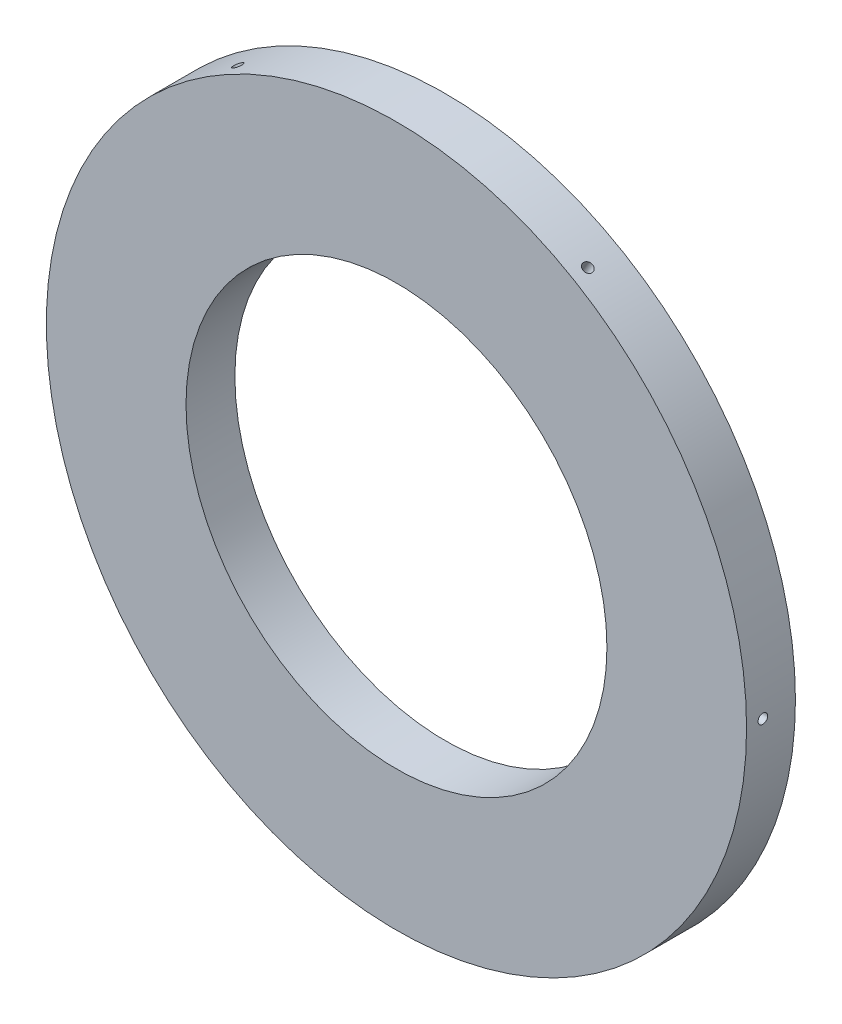
from build123d import *

# Parameters (mm, degrees)
SKETCH1_R                = 81.8896
SKETCH1_R_2              = 49.225199999999994
BOSS_EXTRUDE1_DEPTH      = 11.43
CIRPATTERN1_COUNT        = 6
CUT_EXTRUDE1_DEPTH       = 10.921999999999999
FILLET2_R                = 4.9276
FILLET4_R                = 6.35
FILLET3_R                = 1.5875
CIRPATTERN2_COUNT        = 6
FILLET2_OF_CIRPATTERN2_R = 4.9276
FILLET4_OF_CIRPATTERN2_R = 6.35
FILLET3_OF_CIRPATTERN2_R = 1.5875


with BuildPart() as part:
    # Sketch1 → Boss-Extrude1 (new body)
    with BuildSketch(Plane.XY):
        Circle(SKETCH1_R)
        Circle(SKETCH1_R_2, mode=Mode.SUBTRACT)
    extrude(amount=BOSS_EXTRUDE1_DEPTH)

    # Sketch2 → #4-40 Tapped Hole1 (revolve, cut)
    with BuildSketch(Plane(origin=(81.8896, 0, 7.62), x_dir=(0, 0, -1), z_dir=(-1.2e-16, 1, 0))):
        Polygon((0, 0), (-2.03e-15, 8.273752757686852), (1.130299999999998, 7.594599999999999), (1.130299999999999, -1e-17), align=None)
    f_4_40_tapped_hole1 = revolve(axis=Axis((88.2396, 7.8e-16, 7.62), (-1, -1.2e-16, 0)), mode=Mode.SUBTRACT)

    # CirPattern1: #4-40 Tapped Hole1 ×6 about axis
    cirpattern1_axis = Axis((0, 0, 11.43), (0, 0, -1))
    for i in range(1, CIRPATTERN1_COUNT):
        add(f_4_40_tapped_hole1.rotate(cirpattern1_axis, i * 360 / CIRPATTERN1_COUNT), mode=Mode.SUBTRACT)

    # Sketch3 → Cut-Extrude1 (cut)
    with BuildSketch(Plane.XY):
        with BuildLine():
            ThreePointArc((27.78089806339295, 42.682326925688685), (44.10407573853007, 25.463500000000053), (50.85442844197543, 2.7178))
            Line((50.85442844197543, 2.7178), (81.08206364492705, 2.7178))
            ThreePointArc((81.08206364492705, 2.7177999999999995), (70.25856254806233, 40.56380000000017), (42.894715664868535, 68.86022690777371))
            Line((42.8947156648687, 68.86022690777364), (27.780898063392954, 42.682326925688685))
        make_face()
    cut_extrude1 = extrude(amount=CUT_EXTRUDE1_DEPTH, mode=Mode.SUBTRACT)

    # Fillet2
    fillet2_edges = [part.edges().sort_by_distance(p)[0] for p in [
        (42.89471566486861, 68.86022690777367, 5.460999999999999),
        (81.08206364492705, 2.7177999999999995, 5.460999999999999),
    ]]
    fillet(fillet2_edges, radius=FILLET2_R)

    # Fillet4
    fillet4_edges = [part.edges().sort_by_distance(p)[0] for p in [
        (27.780898063392954, 42.682326925688685, 5.460999999999999),
        (50.85442844197543, 2.717800000000004, 5.460999999999999),
    ]]
    fillet(fillet4_edges, radius=FILLET4_R)

    # Fillet3
    fillet3_edges = [part.edges().sort_by_distance(p)[0] for p in [
        (79.47044523612693, 4.340477622942812, 10.921999999999999),
        (66.18507353377304, 2.7178, 10.921999999999999),
        (44.10407573853008, 25.463500000000057, 10.921999999999999),
        (35.44622060929171, 55.95905503158863, 10.921999999999999),
        (43.49418650408965, 66.65318561307464, 10.921999999999999),
        (70.25856254806236, 40.56380000000009, 10.921999999999999),
        (52.435265307332486, 4.235298019863146, 10.921999999999999),
        (29.885508331465545, 43.292622800395286, 10.921999999999999),
    ]]
    fillet(fillet3_edges, radius=FILLET3_R)

    # CirPattern2: Cut-Extrude1 ×6 about axis
    cirpattern2_axis = Axis((0, 0, 11.43), (0, 0, -1))
    for i in range(1, CIRPATTERN2_COUNT):
        add(cut_extrude1.rotate(cirpattern2_axis, i * 360 / CIRPATTERN2_COUNT), mode=Mode.SUBTRACT)

    # Fillet2 of CirPattern2
    fillet2_of_cirpattern2_edges = [part.edges().sort_by_distance(p)[0] for p in [
        (81.08206364492706, -2.7177999999996842, 5.460999999999999),
        (42.894715664868876, -68.8602269077735, 5.460999999999999),
        (38.18734798005846, -71.57802690777335, 5.460999999999999),
        (-38.187347980058156, -71.5780269077735, 5.460999999999999),
        (-42.894715664868606, -68.86022690777367, 5.460999999999999),
        (-81.08206364492705, -2.7178000000000093, 5.460999999999999),
        (-81.08206364492706, 2.717799999999656, 5.460999999999999),
        (-42.894715664868905, 68.86022690777347, 5.460999999999999),
        (-38.18734798005845, 71.57802690777336, 5.460999999999999),
        (38.187347980058185, 71.5780269077735, 5.460999999999999),
    ]]
    fillet(fillet2_of_cirpattern2_edges, radius=FILLET2_OF_CIRPATTERN2_R)

    # Fillet4 of CirPattern2
    fillet4_of_cirpattern2_edges = [part.edges().sort_by_distance(p)[0] for p in [
        (50.85442844197544, -2.7177999999998654, 5.460999999999999),
        (27.78089806339307, -42.682326925688606, 5.460999999999999),
        (23.073530378582497, -45.40012692568855, 5.460999999999999),
        (-23.073530378582355, -45.40012692568861, 5.460999999999999),
        (-27.78089806339295, -42.682326925688685, 5.460999999999999),
        (-50.85442844197543, -2.71780000000001, 5.460999999999999),
        (-50.85442844197544, 2.717799999999844, 5.460999999999999),
        (-27.780898063393085, 42.68232692568859, 5.460999999999999),
        (-23.07353037858248, 45.400126925688554, 5.460999999999999),
        (23.073530378582372, 45.40012692568862, 5.460999999999999),
    ]]
    fillet(fillet4_of_cirpattern2_edges, radius=FILLET4_OF_CIRPATTERN2_R)

    # Fillet3 of CirPattern2
    fillet3_of_cirpattern2_edges = [part.edges().sort_by_distance(p)[0] for p in [
        (43.494186504089846, -66.65318561307454, 10.921999999999999),
        (35.44622060929187, -55.959055031588555, 10.921999999999999),
        (44.10407573853014, -25.46349999999994, 10.921999999999999),
        (66.18507353377302, -2.7177999999998157, 10.921999999999999),
        (79.47044523612692, -4.340477622942586, 10.921999999999999),
        (70.25856254806249, -40.56379999999989, 10.921999999999999),
        (29.885508331465665, -43.29262280039521, 10.921999999999999),
        (52.4352653073325, -4.235298019863006, 10.921999999999999),
        (-35.97625873203708, -70.99366323601735, 10.921999999999999),
        (-30.738852924481158, -58.67685503158856, 10.921999999999999),
        (7.461e-14, -50.92700000000001, 10.921999999999999),
        (30.738852924481325, -58.676855031588445, 10.921999999999999),
        (35.976258732037294, -70.99366323601723, 10.921999999999999),
        (1.279e-13, -81.12759999999997, 10.921999999999999),
        (-22.549756975866817, -47.52792082025836, 10.921999999999999),
        (22.549756975866963, -47.52792082025829, 10.921999999999999),
        (-79.47044523612693, -4.340477622942822, 10.921999999999999),
        (-66.18507353377304, -2.717800000000008, 10.921999999999999),
        (-44.10407573853008, -25.463500000000064, 10.921999999999999),
        (-35.4462206092917, -55.95905503158864, 10.921999999999999),
        (-43.49418650408964, -66.65318561307464, 10.921999999999999),
        (-70.25856254806236, -40.5638000000001, 10.921999999999999),
        (-52.435265307332486, -4.235298019863152, 10.921999999999999),
        (-29.88550833146554, -43.29262280039529, 10.921999999999999),
        (-43.49418650408987, 66.65318561307451, 10.921999999999999),
        (-35.44622060929189, 55.95905503158854, 10.921999999999999),
        (-44.104075738530156, 25.463499999999925, 10.921999999999999),
        (-66.18507353377302, 2.717799999999791, 10.921999999999999),
        (-79.47044523612692, 4.340477622942558, 10.921999999999999),
        (-70.25856254806249, 40.56379999999986, 10.921999999999999),
        (-29.88550833146568, 43.29262280039519, 10.921999999999999),
        (-52.4352653073325, 4.235298019862984, 10.921999999999999),
        (35.9762587320371, 70.99366323601735, 10.921999999999999),
        (30.73885292448118, 58.67685503158855, 10.921999999999999),
        (-6.04e-14, 50.92700000000001, 10.921999999999999),
        (-30.738852924481307, 58.67685503158846, 10.921999999999999),
        (-35.97625873203727, 70.99366323601724, 10.921999999999999),
        (-1.0658e-13, 81.12759999999999, 10.921999999999999),
        (22.549756975866835, 47.52792082025836, 10.921999999999999),
        (-22.549756975866945, 47.5279208202583, 10.921999999999999),
    ]]
    fillet(fillet3_of_cirpattern2_edges, radius=FILLET3_OF_CIRPATTERN2_R)


solid = part.part
